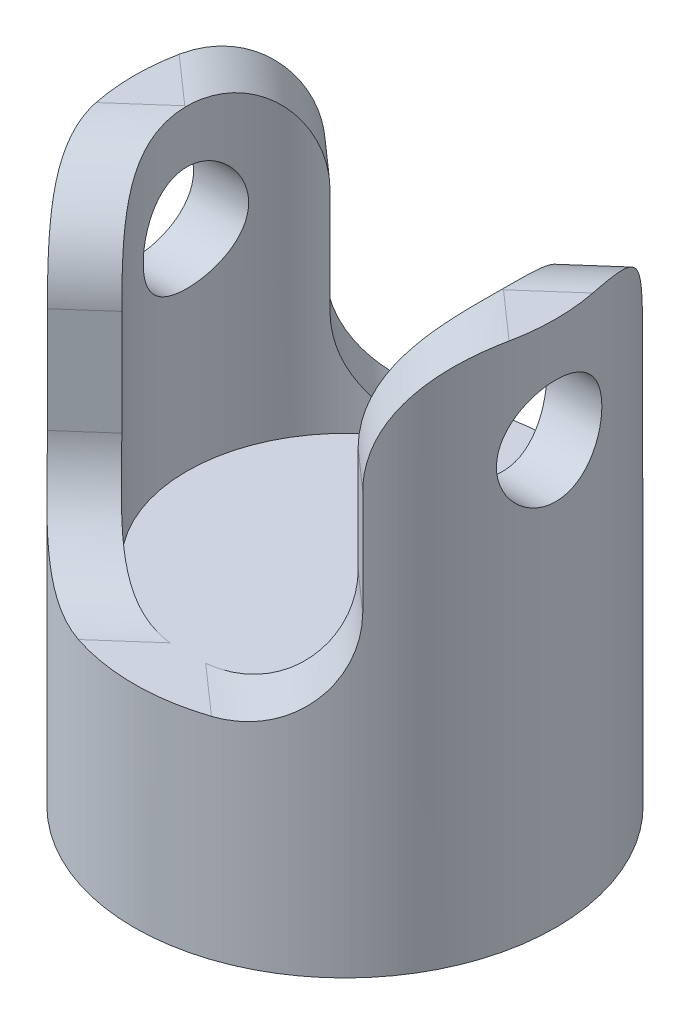
from build123d import *

# Parameters (mm, degrees)
SKETCH1_R               = 6
BOSS_EXTRUDE1_DEPTH     = 6
BOSS_EXTRUDE2_DEPTH     = 9
FILLET1_R               = 3
FILLET2_R               = 3
CUT_EXTRUDE2_DEPTH      = 18.233688096
CUT_EXTRUDE2_DEPTH_BACK = 18.233688096
SKETCH4_R               = 1.5
SKETCH5_R               = 5
CUT_EXTRUDE3_DEPTH      = 4


with BuildPart() as part:
    # Sketch1 → Boss-Extrude1 (new body)
    with BuildSketch(Plane(origin=(0, 0, 0), x_dir=(1, 0, 0), z_dir=(0, 1, 0))):
        with Locations(Location((0, 0, 0), (0, 0, 270))):
            Circle(SKETCH1_R)
    extrude(amount=BOSS_EXTRUDE1_DEPTH)

    # Sketch3 → Boss-Extrude2 (add)
    with BuildSketch(Plane(origin=(0, 6, 0), x_dir=(1, 0, 0), z_dir=(0, 1, 0))):
        with BuildLine():
            ThreePointArc((-4.512030676, 3.954943638), (-5.999972336, -0.01822004), (-4.487927828, -3.982273699))
            Line((-4.487927828, -3.982273699), (-3.362920912, -2.990110858))
            ThreePointArc((-3.362920912, -2.990110858), (-4.499963114, -0.01822004), (-3.38702376, 2.962780797))
            Line((-3.38702376, 2.962780797), (-4.512030676, 3.954943638))
        make_face()
        with BuildLine():
            Line((3.362920912, -2.990110858), (4.487927828, -3.982273699))
            ThreePointArc((4.487927828, -3.982273699), (5.609258729, -2.129839552), (6, 0))
            ThreePointArc((6, 0), (5.615700493, 2.112796245), (4.512030676, 3.954943638))
            Line((4.512030676, 3.954943638), (3.38702376, 2.962780797))
            ThreePointArc((3.38702376, 2.962780797), (4.499963114, -0.01822004), (3.362920912, -2.990110858))
        make_face()
    extrude(amount=BOSS_EXTRUDE2_DEPTH)

    # Fillet1
    # the kernel refuses this fillet: 3 mm, written as the material it takes off along each edge
    with BuildSketch(Plane(origin=(-2.262079088, 15, -1.970672851), x_dir=(0, -1, 0), z_dir=(0.7499999999999997, 0, 0.661437827766148)), Plane(origin=(10.137030676, 15, -8.915727346), x_dir=(0, -1, 0), z_dir=(-0.7499999999999997, 0, 0.661437827766148)), Plane(origin=(2.23797624, 15, 1.998002911), x_dir=(0, -1, 0), z_dir=(-0.7499999999999997, 0, -0.661437827766148)), Plane(origin=(-10.112927828, 15, 8.943057407), x_dir=(0, -1, 0), z_dir=(0.7499999999999997, 0, -0.661437827766148))) as fillet1_piece_1:
        with BuildLine():
            CenterArc((FILLET1_R, FILLET1_R), FILLET1_R, 180, 90)
            Line((0, FILLET1_R), (0, 0))
            Line((0, 0), (FILLET1_R, 0))
        make_face()
    extrude(amount=16.500009221, mode=Mode.SUBTRACT)

    # Fillet2
    # the kernel refuses this fillet: 3 mm, written as the material it adds along each edge
    with BuildSketch(Plane(origin=(-2.262079088, 6, -1.970672851), x_dir=(-0.661437827766148, 0, 0.7499999999999997), z_dir=(0.7499999999999997, 0, 0.661437827766148))) as fillet2_piece_1_section:
        with BuildLine():
            CenterArc((FILLET2_R, -FILLET2_R), FILLET2_R, 90, 90)
            Line((0, -FILLET2_R), (0, 0))
            Line((0, 0), (FILLET2_R, 0))
        make_face()
    fillet2_piece_1 = extrude(amount=16.500009221, mode=Mode.PRIVATE)
    fillet2_piece_1 = fillet2_piece_1 & Plane(origin=(0, 6.66993204, 0), x_dir=(0, 0, 1), z_dir=(0, -1, 0)) * Cylinder(6, 46, mode=Mode.PRIVATE)
    fillet2_piece_1 = fillet2_piece_1 - Plane(origin=(0, 6.66993204, 0), x_dir=(0.7526719465807102, 0, -0.6583957326945586), z_dir=(0, -1, 0)) * Cylinder(4.5, 46, mode=Mode.PRIVATE)
    add(fillet2_piece_1)
    with BuildSketch(Plane(origin=(10.137030676, 6, -8.915727346), x_dir=(-0.661437827766148, 0, -0.7499999999999998), z_dir=(-0.7499999999999997, 0, 0.661437827766148))) as fillet2_piece_2_section:
        with BuildLine():
            CenterArc((FILLET2_R, -FILLET2_R), FILLET2_R, 90, 90)
            Line((0, -FILLET2_R), (0, 0))
            Line((0, 0), (FILLET2_R, 0))
        make_face()
    fillet2_piece_2 = extrude(amount=16.500009221, mode=Mode.PRIVATE)
    fillet2_piece_2 = fillet2_piece_2 & Plane(origin=(0, 6.67033371, 0), x_dir=(0, 0, 1), z_dir=(0, -1, 0)) * Cylinder(6, 46, mode=Mode.PRIVATE)
    fillet2_piece_2 = fillet2_piece_2 - Plane(origin=(0, 6.67033371, 0), x_dir=(0.7526719465807102, 0, -0.6583957326945586), z_dir=(0, -1, 0)) * Cylinder(4.5, 46, mode=Mode.PRIVATE)
    add(fillet2_piece_2)
    with BuildSketch(Plane(origin=(-10.112927828, 6, 8.943057407), x_dir=(0.661437827766148, 0, 0.7499999999999998), z_dir=(0.7499999999999997, 0, -0.661437827766148))) as fillet2_piece_3_section:
        with BuildLine():
            CenterArc((FILLET2_R, -FILLET2_R), FILLET2_R, 90, 90)
            Line((0, -FILLET2_R), (0, 0))
            Line((0, 0), (FILLET2_R, 0))
        make_face()
    fillet2_piece_3 = extrude(amount=16.500009221, mode=Mode.PRIVATE)
    fillet2_piece_3 = fillet2_piece_3 & Plane(origin=(0, 6.669931793, 0), x_dir=(0, 0, 1), z_dir=(0, -1, 0)) * Cylinder(6, 46, mode=Mode.PRIVATE)
    fillet2_piece_3 = fillet2_piece_3 - Plane(origin=(0, 6.669931793, 0), x_dir=(-0.7473157581885724, 0, 0.6644690794634761), z_dir=(0, -1, 0)) * Cylinder(4.5, 46, mode=Mode.PRIVATE)
    add(fillet2_piece_3)
    with BuildSketch(Plane(origin=(2.23797624, 6, 1.998002911), x_dir=(0.661437827766148, 0, -0.7499999999999997), z_dir=(-0.7499999999999997, 0, -0.661437827766148))) as fillet2_piece_4_section:
        with BuildLine():
            CenterArc((FILLET2_R, -FILLET2_R), FILLET2_R, 90, 90)
            Line((0, -FILLET2_R), (0, 0))
            Line((0, 0), (FILLET2_R, 0))
        make_face()
    fillet2_piece_4 = extrude(amount=16.500009221, mode=Mode.PRIVATE)
    fillet2_piece_4 = fillet2_piece_4 & Plane(origin=(0, 6.670333879, 0), x_dir=(0, 0, 1), z_dir=(0, -1, 0)) * Cylinder(6, 46, mode=Mode.PRIVATE)
    fillet2_piece_4 = fillet2_piece_4 - Plane(origin=(0, 6.670333879, 0), x_dir=(-0.7473157581885724, 0, 0.6644690794634761), z_dir=(0, -1, 0)) * Cylinder(4.5, 46, mode=Mode.PRIVATE)
    add(fillet2_piece_4)

    # Sketch4 → Cut-Extrude2 (cut, two sides: drawn at the far end of the back side and taken through both)
    with BuildSketch(Plane(origin=(0, 0, 0), x_dir=(0, 0, -1), z_dir=(1, 0, 0)).offset(-CUT_EXTRUDE2_DEPTH_BACK)):
        with Locations((0, 12)):
            Circle(SKETCH4_R)
    extrude(amount=CUT_EXTRUDE2_DEPTH + CUT_EXTRUDE2_DEPTH_BACK, mode=Mode.SUBTRACT)

    # Sketch5 → Cut-Extrude3 (cut)
    with BuildSketch(Plane.XZ):
        with Locations(Location((0, 0, 0), (0, 0, 270))):
            Circle(SKETCH5_R)
    extrude(amount=-CUT_EXTRUDE3_DEPTH, mode=Mode.SUBTRACT)


solid = part.part
